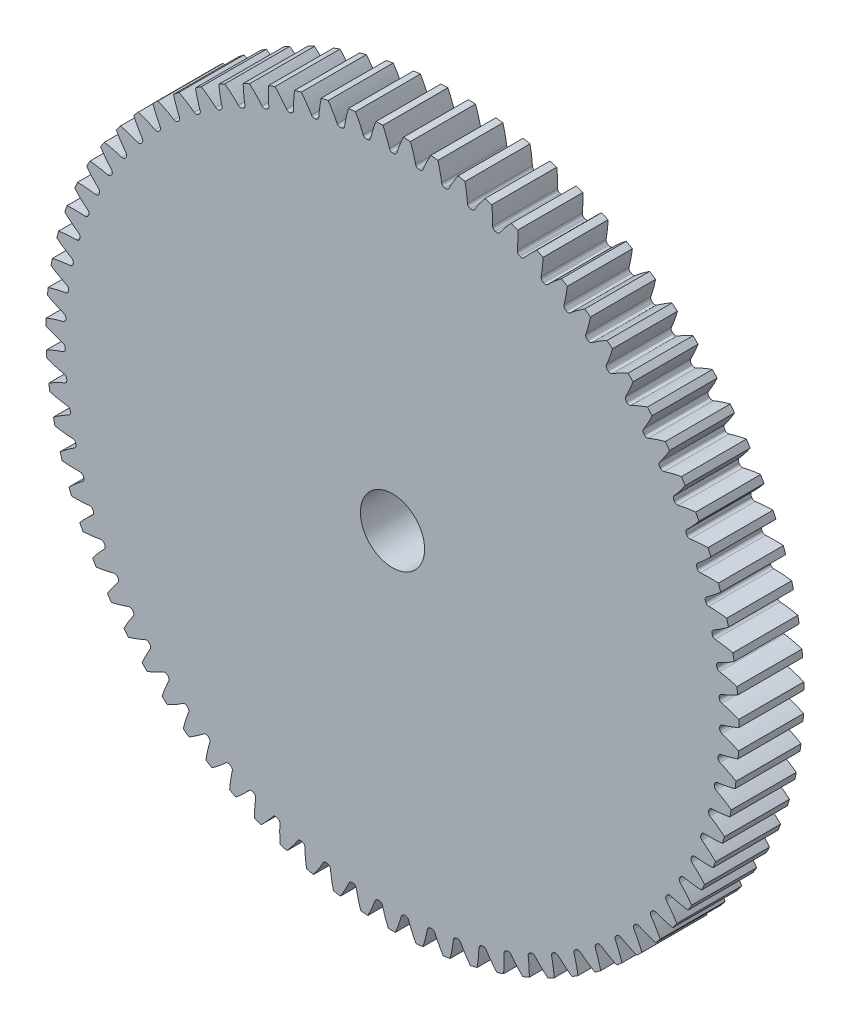
from build123d import *

# Parameters (mm, degrees)
SKETCH3_R         = 51.435
GEARBODY_DEPTH    = 9.651999879
TOOTHCUT_DEPTH    = 74.377650219
CIRPATTERN1_COUNT = 79
BOREDIA_R         = 4.7625
BORE_DEPTH        = 12700


with BuildPart() as part:
    # Sketch3 → gearBody (new body)
    with BuildSketch(Plane.XY):
        Circle(SKETCH3_R)
    extrude(amount=GEARBODY_DEPTH)

    # Sketch2 → toothCut (cut, through all)
    with BuildSketch(Plane.XY):
        with BuildLine():
            ThreePointArc((48.576810759, -1.140610614), (48.578673696, -1.058299566), (48.580397162, -0.97598548))
            ThreePointArc((48.580397162, -0.97598548), (48.681406085, -0.687861503), (48.933496161, -0.515615105))
            ThreePointArc((48.933496161, -0.515615105), (54.890880019, 2.397386509), (59.512297795, 7.153277442))
            ThreePointArc((59.512297795, 7.153277442), (59.926443251, -1.3055138), (59.144311429, -9.738243817))
            ThreePointArc((59.144311429, -9.738243817), (54.73439665, -4.785602858), (48.909525685, -1.615921631))
            ThreePointArc((48.909525685, -1.615921631), (48.665176087, -1.43286016), (48.576810759, -1.140610614))
        make_face()
    toothcut = extrude(amount=TOOTHCUT_DEPTH, mode=Mode.SUBTRACT)

    # CirPattern1: toothCut ×79 about axis
    cirpattern1_axis = Axis((0, 0, 9.651999879), (0, 0, -1))
    for i in range(1, CIRPATTERN1_COUNT):
        add(toothcut.rotate(cirpattern1_axis, i * 360 / CIRPATTERN1_COUNT), mode=Mode.SUBTRACT)

    # boreDia → bore (cut, symmetric)
    with BuildSketch(Plane.XY):
        Circle(BOREDIA_R)
    extrude(amount=BORE_DEPTH, both=True, mode=Mode.SUBTRACT)


solid = part.part
